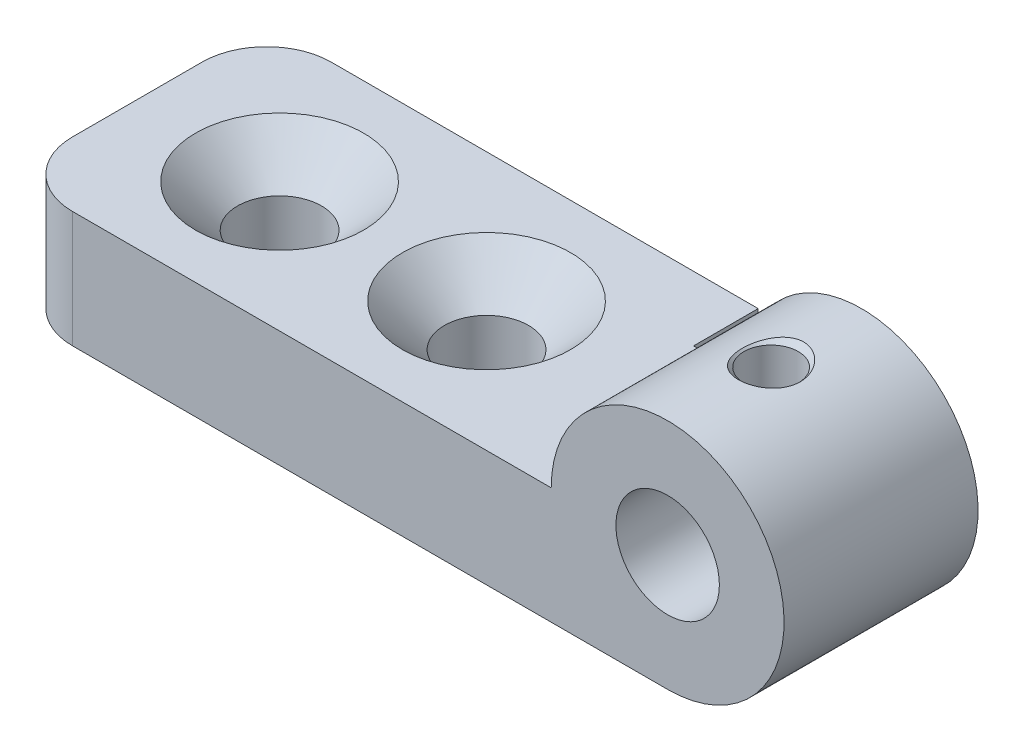
from build123d import *

# Parameters (mm, degrees)
SKETCH_1_R                        = 4
EXTRUDE_1_DEPTH                   = 10
CUT_EXTRUDE_1_DEPTH               = 62.489836559
CUT_EXTRUDE_1_DEPTH_BACK          = 62.489836559
HOLE_WIZARD_6_5_6_5_1_D           = 6.5
HOLE_WIZARD_6_5_6_5_1_DEPTH       = 13
HOLE_WIZARD_6_5_6_5_1_CSINK_D     = 13
HOLE_WIZARD_6_5_6_5_1_CSINK_ANGLE = 90
HOLE_WIZARD_6_5_6_5_1_TIP         = 1.952797012
FILLET_1_R                        = 5


# Read off the part's stored shape, not the designer's step: M5 螺纹孔1
with BuildPart() as part:
    # 草图1 → 凸台-拉伸1 (new, symmetric)
    with BuildSketch(Plane.XY):
        with BuildLine():
            Line((0, 0), (51, 0))
            ThreePointArc((51, 0), (57.363961031, 15.363961031), (42, 9))
            Line((42, 9), (0, 9))
            Line((0, 9), (0, 0))
        make_face()
        with Locations((51, 9)):
            Circle(SKETCH_1_R, mode=Mode.SUBTRACT)
    extrude(amount=EXTRUDE_1_DEPTH, both=True)

    # 草图2 → 切除-拉伸1 (cut, two sides: drawn at the far end of the back side and taken through both)
    with BuildSketch(Plane(origin=(0, 9, 0), x_dir=(1, 0, 0), z_dir=(0, 1, 0)).offset(-CUT_EXTRUDE_1_DEPTH_BACK)):
        Polygon((193.693168769, 5), (60, 5), (38, 5), (38, 10), (38, 143.693168769), (215.856075393, 343.349548449), (371.549244162, 204.65637968), align=None)
    extrude(amount=CUT_EXTRUDE_1_DEPTH + CUT_EXTRUDE_1_DEPTH_BACK, mode=Mode.SUBTRACT)

    # Ø6.5 (6.5) 直径孔1
    with Locations(Plane(origin=(0, 9, 0), x_dir=(1, 0, 0), z_dir=(0, 1, 0))):
        with Locations((11, 0), (27, 0)):
            CounterSinkHole(HOLE_WIZARD_6_5_6_5_1_D / 2, HOLE_WIZARD_6_5_6_5_1_CSINK_D / 2, depth=HOLE_WIZARD_6_5_6_5_1_DEPTH, counter_sink_angle=HOLE_WIZARD_6_5_6_5_1_CSINK_ANGLE)
            with Locations((0, 0, -(HOLE_WIZARD_6_5_6_5_1_DEPTH + HOLE_WIZARD_6_5_6_5_1_TIP / 2))):  # 118° drill point
                Cone(0, HOLE_WIZARD_6_5_6_5_1_D / 2, HOLE_WIZARD_6_5_6_5_1_TIP, mode=Mode.SUBTRACT)

    # M5 螺纹孔1 outline → M5 螺纹孔1 (revolve, cut)
    with BuildSketch(Plane(origin=(51, 0, 2), x_dir=(1, 0, 0), z_dir=(0, 0, 1))):
        Polygon((2.52510553, 18.00010553), (0, 18.00010553), (0, 12.404132041), (2.1, 12.404132041), (2.1, 17.575), align=None)
    revolve(axis=Axis((51, 0, 2), (0, 1, 0)), mode=Mode.SUBTRACT)

    # 圆角1
    fillet_1_edges = [part.edges().sort_by_distance(p)[0] for p in [
        (0, 4.5, 10),
        (0, 4.5, -10),
    ]]
    fillet(fillet_1_edges, radius=FILLET_1_R)


solid = part.part
